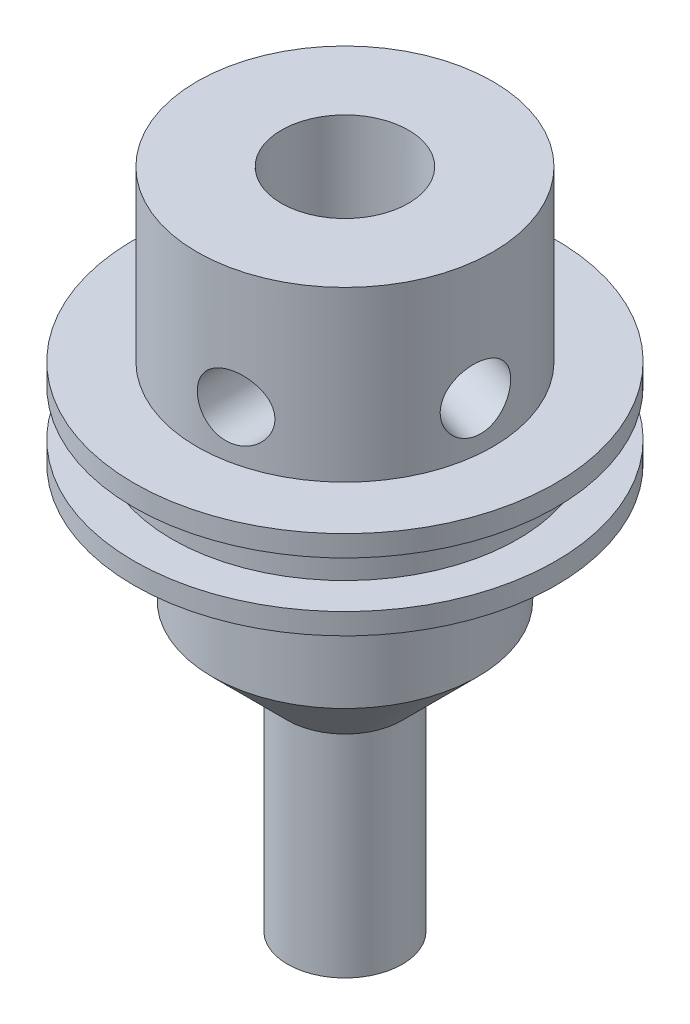
from build123d import *

# Parameters (mm, degrees)
SKETCH2_R                = 12.7
SOLID_CYLINDER_DEPTH     = 39.878
ALL_THROUGH_HOLE_REACH   = 45.736
SKETCH3_R                = 2.032
SKETCH4_R                = 3.82524
SWIRL_CHAMBER_DEPTH      = 19.05
TOP_START                = -10.16
SKETCH5_R                = 12.7
SKETCH5_R_2              = 8.90524
TOP_OUTER_CUT_DEPTH      = 10.16
SKETCH8_W                = 2.286
SKETCH8_H                = 2.794
SKETCH9_W                = 4.699
SKETCH9_H                = 24.384
INNER_CHAMFER_SIZE       = 2.54
INLET_HOLE_REACH         = 45.736
INLET_HOLE_END_RADIUS    = 8.90524
SKETCH12_R               = 1.905
INLET_HOLE_PATTERN_COUNT = 5


with BuildPart() as part:
    # Sketch2 → Solid Cylinder (new body)
    with BuildSketch(Plane(origin=(0, 0, 0), x_dir=(1, 0, 0), z_dir=(0, 1, 0))):
        with Locations(Location((0, 0, 0), (0, 0, 270))):
            Circle(SKETCH2_R)
    extrude(amount=SOLID_CYLINDER_DEPTH)

    # Sketch3 → All Through Hole (cut, up to next)
    with BuildSketch(Plane(origin=(0, 39.878, 0), x_dir=(1, 0, 0), z_dir=(0, 1, 0)), mode=Mode.PRIVATE) as all_through_hole_sk1:
        with Locations(Location((0, 0, 0), (0, 0, 270))):
            Circle(SKETCH3_R)
    all_through_hole_tool1 = extrude(all_through_hole_sk1.sketch, amount=-ALL_THROUGH_HOLE_REACH, mode=Mode.PRIVATE) & part.part
    add(all_through_hole_tool1.solids().sort_by_distance((0, 39.878, 0))[0], mode=Mode.SUBTRACT)

    # Sketch4 → Swirl Chamber (cut)
    with BuildSketch(Plane(origin=(0, 39.878, 0), x_dir=(1, 0, 0), z_dir=(0, 1, 0))):
        with Locations(Location((0, 0, 0), (0, 0, 270))):
            Circle(SKETCH4_R)
    extrude(amount=-SWIRL_CHAMBER_DEPTH, mode=Mode.SUBTRACT)

    # Sketch5 → Top Outer cut (cut)
    with BuildSketch(Plane(origin=(0, 39.878, 0), x_dir=(1, 0, 0), z_dir=(0, 1, 0)).offset(TOP_START)):
        with Locations(Location((0, 0, 0), (0, 0, 270))):
            Circle(SKETCH5_R)
        with Locations(Location((0, 0, 0), (0, 0, 270))):
            Circle(SKETCH5_R_2, mode=Mode.SUBTRACT)
    extrude(amount=TOP_OUTER_CUT_DEPTH, mode=Mode.SUBTRACT)

    # Sketch8 → O Ring Cut (revolve, cut)
    with BuildSketch(Plane.XY, mode=Mode.PRIVATE) as o_ring_cut_sk:
        with Locations((11.557, 27.051)):
            Rectangle(SKETCH8_W, SKETCH8_H)
    revolve(o_ring_cut_sk.sketch.rotate(Axis((0, 55, 0), (0, -1, 0)), 90), axis=Axis((0, 55, 0), (0, -1, 0)), mode=Mode.SUBTRACT)

    # Sketch9 → Base Support (revolve, cut)
    with BuildSketch(Plane.XY, mode=Mode.PRIVATE) as base_support_sk:
        with Locations((10.3505, 12.192)):
            Rectangle(SKETCH9_W, SKETCH9_H)
    revolve(base_support_sk.sketch.rotate(Axis((0, 55, 0), (0, -1, 0)), 90), axis=Axis((0, 55, 0), (0, -1, 0)), mode=Mode.SUBTRACT)

    # Inner Chamfer
    # the kernel refuses this chamfer: 2.54 mm, written as the material it takes off along each edge
    with BuildSketch(Plane(origin=(0, 20.828, 0), x_dir=(0, 0, 1), z_dir=(-1, 0, 0))) as inner_chamfer_piece_1_section:
        Polygon((2.032, -INNER_CHAMFER_SIZE), (2.032 + INNER_CHAMFER_SIZE, 0), (2.032, 0), align=None)
    inner_chamfer_piece_1 = revolve(axis=Axis((0, 20.828, 0), (0, 1, 0)), mode=Mode.PRIVATE)
    inner_chamfer_piece_1 = inner_chamfer_piece_1 & Plane(origin=(0, 19.17557145, 0), x_dir=(0, 0, 1), z_dir=(0, 1, 0)) * Cylinder(3.82524, 19, mode=Mode.PRIVATE)
    add(inner_chamfer_piece_1, mode=Mode.SUBTRACT)

    # Inlet Hole: up to this cylinder (the profile starts inside it)
    inlet_hole_end = Plane(origin=(0, 32.639, 0), z_dir=(0, 1, 0)) * Cylinder(INLET_HOLE_END_RADIUS, 110.28248, mode=Mode.PRIVATE)
    # Sketch12 → Inlet Hole (cut, up to the surface)
    with BuildSketch(Plane.XY, mode=Mode.PRIVATE) as inlet_hole_sk1:
        with Locations(Location((1.92024, 32.639, 0), (0, 0, 180))):
            Circle(SKETCH12_R)
    inlet_hole_tool1 = extrude(inlet_hole_sk1.sketch, amount=INLET_HOLE_REACH, mode=Mode.PRIVATE) & inlet_hole_end
    inlet_hole = inlet_hole_tool1.solids().sort_by_distance((1.92024, 32.639, 0))[0]
    add(inlet_hole, mode=Mode.SUBTRACT)

    # Inlet Hole Pattern: Inlet Hole ×5 about axis
    inlet_hole_pattern_axis = Axis((0, 55, 0), (0, -1, 0))
    for i in range(1, INLET_HOLE_PATTERN_COUNT):
        add(inlet_hole.rotate(inlet_hole_pattern_axis, i * 360 / INLET_HOLE_PATTERN_COUNT), mode=Mode.SUBTRACT)

    # Sketch13 → Outer Chamfer and Stem (revolve, cut)
    with BuildSketch(Plane.XY, mode=Mode.PRIVATE) as outer_chamfer_and_stem_sk:
        Polygon((-8.001, 17.272), (-3.4544, 12.7254), (-3.4544, 0), (-8.001, 0), align=None)
    revolve(outer_chamfer_and_stem_sk.sketch.rotate(Axis((0, 46.59080533, 0), (0, -1, 0)), 270), axis=Axis((0, 46.59080533, 0), (0, -1, 0)), mode=Mode.SUBTRACT)


solid = part.part
